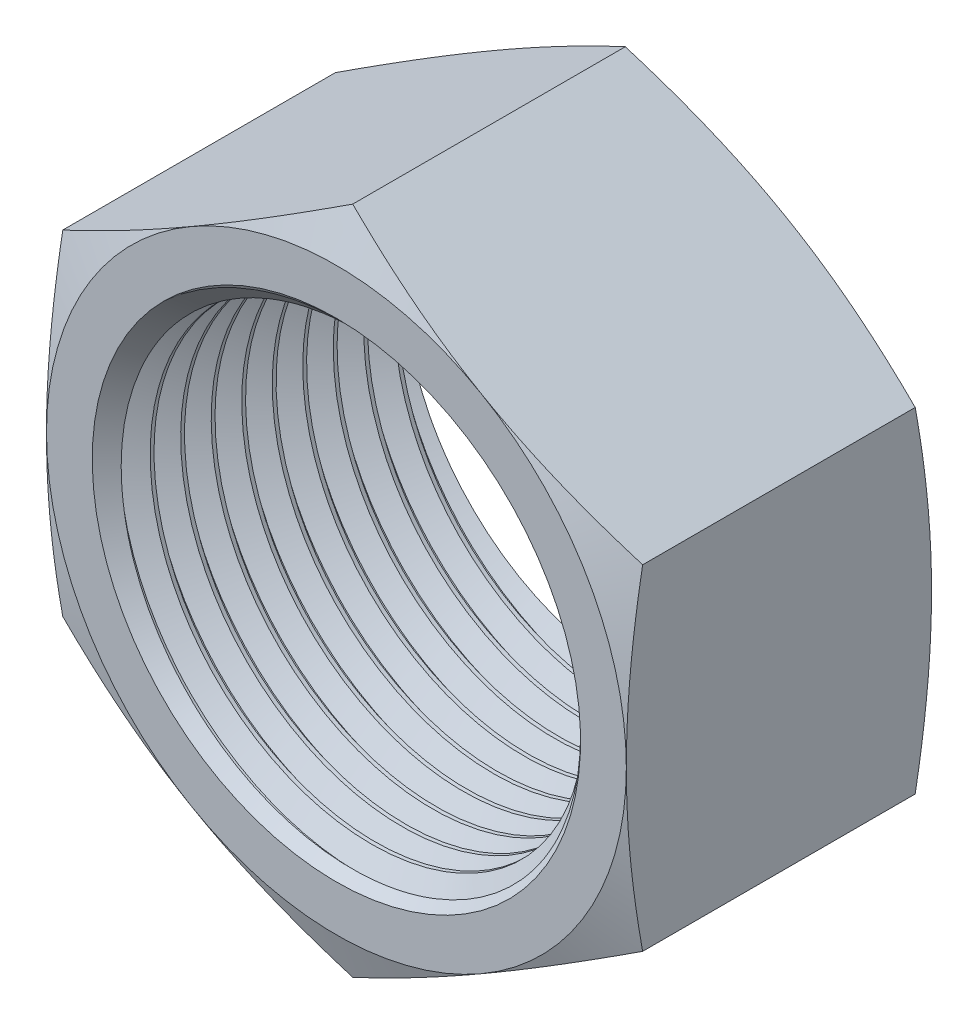
from build123d import *

# Parameters (mm, degrees)
SKETCH1_R               = 8
BOSS_EXTRUDE1_DEPTH     = 5
SKETCH5_OUTSIDE_W       = 129.474
SKETCH5_OUTSIDE_H       = 132.414
SKETCH5_OUTSIDE_R       = 9.5
CUT_EXTRUDE2_DEPTH      = 18.62337463
CUT_EXTRUDE2_DRAFT      = -70
MIRROR1_COPY_1_SKETCH_W = 129.474
MIRROR1_COPY_1_SKETCH_H = 132.414
MIRROR1_COPY_1_SKETCH_R = 9.5
MIRROR1_COPY_1_DEPTH    = 18.62337463
MIRROR1_COPY_1_DRAFT    = -70
SWEEP1_PITCH            = 1
SKETCH4_R               = 8
CUT_EXTRUDE1_DEPTH      = 19.209534535
CUT_EXTRUDE1_TAPER      = -20
SKETCH11_R              = 9.5
CUT_EXTRUDE6_DEPTH      = 18.623842454


with BuildPart() as part:
    # Sketch1 → Boss-Extrude1 (new, symmetric)
    with BuildSketch(Plane.XY):
        Polygon((9.5, -5.484827557), (9.5, 5.484827557), (0, 10.969655115), (-9.5, 5.484827557), (-9.5, -5.484827557), (0, -10.969655115), align=None)
        Circle(SKETCH1_R, mode=Mode.SUBTRACT)
    extrude(amount=BOSS_EXTRUDE1_DEPTH, both=True)


with BuildPart() as cut_extrude2_tool:
    # Sketch5 outside → Cut-Extrude2 (with draft: the straight prism first)
    with BuildSketch(Plane.XY.offset(5)):
        Rectangle(SKETCH5_OUTSIDE_W, SKETCH5_OUTSIDE_H)
        Circle(SKETCH5_OUTSIDE_R, mode=Mode.SUBTRACT)
    extrude(amount=-CUT_EXTRUDE2_DEPTH)
    # Cut-Extrude2: the draft: its side faces are tilted about the plane it starts from
    cut_extrude2_sides = [cut_extrude2_tool.faces().sort_by_distance(p)[0] for p in [
        (0, -66.207, -4.311687315),
        (64.737, 0, -4.311687315),
        (0, 66.207, -4.311687315),
        (-64.737, 0, -4.311687315),
        (-9.5, 0, -4.311687315),
    ]]
    draft(cut_extrude2_sides, Plane.XY.offset(5), CUT_EXTRUDE2_DRAFT)


with BuildPart() as part_1:
    add(part.part)

    # Cut-Extrude2: cut by cut_extrude2_tool
    add(cut_extrude2_tool.part, mode=Mode.SUBTRACT)


with BuildPart() as mirror1_copy_1_tool:
    # Mirror1 copy 1 sketch → Mirror1 copy 1 (with draft: the straight prism first)
    with BuildSketch(Plane(origin=(0, 0, -5), x_dir=(1, 0, 0), z_dir=(0, 0, -1))):
        Rectangle(MIRROR1_COPY_1_SKETCH_W, MIRROR1_COPY_1_SKETCH_H)
        Circle(MIRROR1_COPY_1_SKETCH_R, mode=Mode.SUBTRACT)
    extrude(amount=-MIRROR1_COPY_1_DEPTH)
    # Mirror1 copy 1: the draft: its side faces are tilted about the plane it starts from
    mirror1_copy_1_sides = [mirror1_copy_1_tool.faces().sort_by_distance(p)[0] for p in [
        (0, -66.207, 4.311687315),
        (64.737, 0, 4.311687315),
        (0, 66.207, 4.311687315),
        (-64.737, 0, 4.311687315),
        (-9.5, 0, 4.311687315),
    ]]
    draft(mirror1_copy_1_sides, Plane(origin=(0, 0, -5), x_dir=(1, 0, 0), z_dir=(0, 0, -1)), MIRROR1_COPY_1_DRAFT)


with BuildPart() as part_2:
    add(part_1.part)

    # Mirror1 copy 1: cut by mirror1_copy_1_tool
    add(mirror1_copy_1_tool.part, mode=Mode.SUBTRACT)

    # Sweep1: arcs per turn and ends read off the stored shape
    # Sweep1: the profile of Sketch3 profile screwed along a right-hand helix through 11 turns, 8 arcs to a turn; built about Z, then put on its axis
    sweep1_z = Axis((0, 0, 0), (0, 0, 1))
    sweep1_corners = [(8.0003, 0, 0.000173205), (8.0003, 0, -0.875173205), (7.350480947, 0, -0.5), (7.350480947, 0, -0.375)]
    with BuildLine(mode=Mode.PRIVATE) as sweep1_profile:
        Line(sweep1_corners[0], sweep1_corners[1])
        Line(sweep1_corners[1], sweep1_corners[2])
        Line(sweep1_corners[2], sweep1_corners[3])
        Line(sweep1_corners[3], sweep1_corners[0])
    sweep1_cap = Face(sweep1_profile.wire())
    sweep1_turn_angles = [0, 22.5, 45, 67.5, 90, 112.5, 135, 157.5, 180, 202.5, 225, 247.5, 270, 292.5, 315, 337.5, 360]
    sweep1_turn_weights = [1, 0.9238795325112867, 1, 0.9238795325112867, 1, 0.9238795325112867, 1, 0.9238795325112867, 1, 0.9238795325112867, 1, 0.9238795325112867, 1, 0.9238795325112867, 1, 0.9238795325112867, 1]
    sweep1_turn_rails = [Edge.make_bspline([Vector(p[0], p[1], 0).rotate(sweep1_z, sweep1_turn_angles[k]) / sweep1_turn_weights[k] + Vector(0, 0, p[2] + SWEEP1_PITCH * sweep1_turn_angles[k] / 360) for k in range(17)], [0, 0, 0, 1, 1, 2, 2, 3, 3, 4, 4, 5, 5, 6, 6, 7, 7, 8, 8, 8], 2, sweep1_turn_weights) for p in sweep1_corners]
    sweep1_turn_sides = [Face.make_surface_from_curves(sweep1_turn_rails[p[0]], sweep1_turn_rails[p[1]]) for p in [(0, 1), (1, 2), (2, 3), (3, 0)]]
    sweep1 = Plane(origin=(0, 0, 5), x_dir=(0, 1, 0), z_dir=(0, 0, -1)) * Solid(Shell([*[p.moved(Location((0, 0, SWEEP1_PITCH * i))) for i in range(11) for p in sweep1_turn_sides], sweep1_cap, sweep1_cap.rotate(sweep1_z, 3960).moved(Location((0, 0, SWEEP1_PITCH * 3960 / 360)))]))
    add(sweep1)

    # Sketch4 → Cut-Extrude1 (cut)
    with BuildSketch(Plane.XY.offset(5)):
        Circle(SKETCH4_R)
    extrude(amount=CUT_EXTRUDE1_DEPTH, taper=CUT_EXTRUDE1_TAPER, mode=Mode.SUBTRACT)

    # Cut-Extrude1 cone 1 section (through the dimple's axis) → Cut-Extrude1 other way (revolve, cut)
    with BuildSketch(Plane(origin=(0, 0, 5), x_dir=(0, -1, 0), z_dir=(1, 0, 0))):
        Polygon((0, 0), (8, 0), (0, 8), align=None)
    revolve(axis=Axis((0, 0, 5), (0, 0, -1)), mode=Mode.SUBTRACT)

    # Sketch11 → Cut-Extrude6 (cut, through all)
    with BuildSketch(Plane(origin=(0, 0, -5), x_dir=(-1, 0, 0), z_dir=(0, 0, -1))):
        Circle(SKETCH11_R)
    extrude(amount=CUT_EXTRUDE6_DEPTH, mode=Mode.SUBTRACT)


solid = part_2.part
